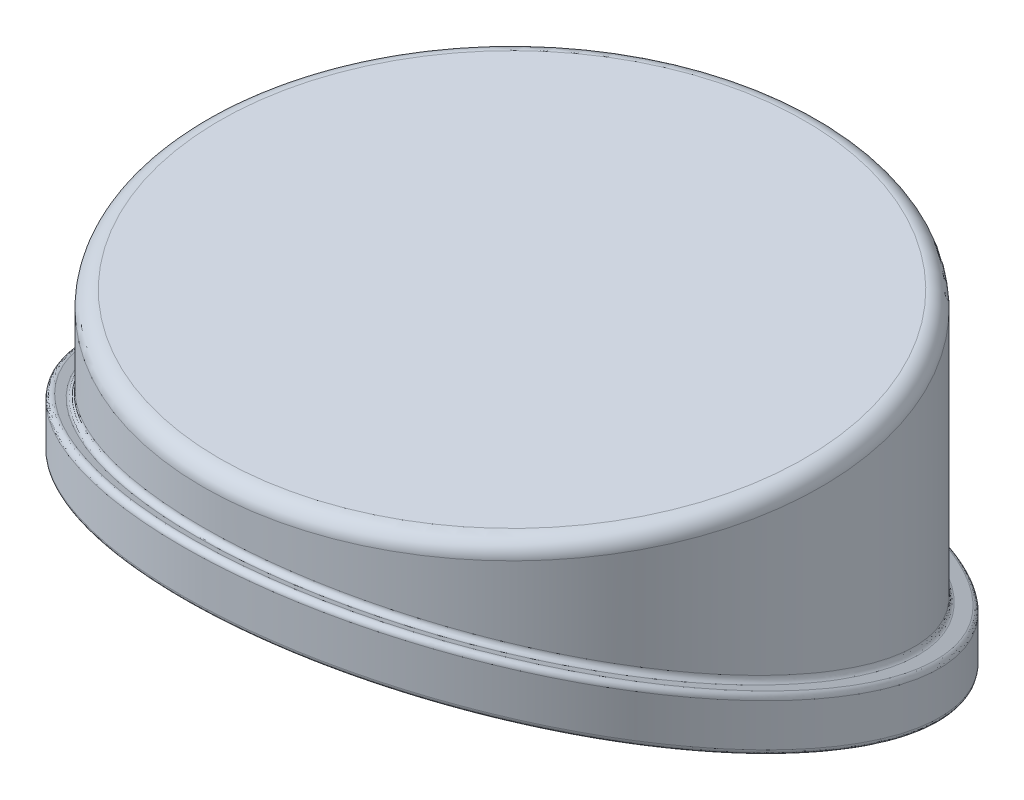
from build123d import *

# Parameters (mm, degrees)
SKETCH3_R                            = 40
BOSS_EXTRUDE3_DEPTH                  = 12.57807803
BOSS_EXTRUDE4_REACH                  = 59.95
BOSS_EXTRUDE4_END_RADIUS             = 40
BOSS_EXTRUDE4_DIRECTION_2_REACH      = 59.95
BOSS_EXTRUDE4_DIRECTION_2_END_RADIUS = 40
CUT_EXTRUDE3_REACH                   = 80.022
CUT_EXTRUDE3_OFFSET_FROM_SURFACE     = 6
SKETCH8_R                            = 40
SKETCH8_R_2                          = 37.5
FILLET1_R                            = 0.6
FILLET2_R                            = 2


with BuildPart() as part:
    # Sketch3 → Boss-Extrude3 (new body)
    with BuildSketch(Plane(origin=(0, 0, 0), x_dir=(1, 0, 0), z_dir=(0, 1, 0))):
        Circle(SKETCH3_R)
    extrude(amount=BOSS_EXTRUDE3_DEPTH)

    # Boss-Extrude4: up to this cylinder (the profile starts inside it)
    boss_extrude4_end = Plane(origin=(0, -10.666677, 0), z_dir=(0, -1, 0)) * Cylinder(BOSS_EXTRUDE4_END_RADIUS, 200.9, mode=Mode.PRIVATE)
    # Sketch6 → Boss-Extrude4 (add, up to the surface)
    with BuildSketch(Plane(origin=(0, 0, 0), x_dir=(0, 0, -1), z_dir=(1, 0, 0)), mode=Mode.PRIVATE) as boss_extrude4_sk1:
        Polygon((-40, 0), (40, -32.000030666), (40, 0), align=None)
    boss_extrude4_tool1 = extrude(boss_extrude4_sk1.sketch, amount=BOSS_EXTRUDE4_REACH, mode=Mode.PRIVATE) & boss_extrude4_end
    add(boss_extrude4_tool1.solids().sort_by_distance((0, -10.666677, -13.333333))[0])

    # Boss-Extrude4 direction 2: up to this cylinder (the profile starts inside it)
    boss_extrude4_direction_2_end = Plane(origin=(0, -10.666677, 0), z_dir=(0, -1, 0)) * Cylinder(BOSS_EXTRUDE4_DIRECTION_2_END_RADIUS, 200.9, mode=Mode.PRIVATE)
    # Sketch6 → Boss-Extrude4 direction 2 (add, up to the surface)
    with BuildSketch(Plane(origin=(0, 0, 0), x_dir=(0, 0, -1), z_dir=(1, 0, 0)), mode=Mode.PRIVATE) as boss_extrude4_direction_2_sk1:
        Polygon((-40, 0), (40, -32.000030666), (40, 0), align=None)
    boss_extrude4_direction_2_tool1 = extrude(boss_extrude4_direction_2_sk1.sketch, amount=-BOSS_EXTRUDE4_DIRECTION_2_REACH, mode=Mode.PRIVATE) & boss_extrude4_direction_2_end
    add(boss_extrude4_direction_2_tool1.solids().sort_by_distance((0, -10.666677, -13.333333))[0])

    # Cut-Extrude3: up to this face of the body (flat: up to its plane, moved by the offset)
    cut_extrude3_end = Plane(part.part.faces().sort_by_distance((0, -16.000015333, 0))[0]).offset(-CUT_EXTRUDE3_OFFSET_FROM_SURFACE)
    # Sketch8 → Cut-Extrude3 (cut, up to the picked face)
    with BuildSketch(Plane(origin=(0, 12.57807803, 0), x_dir=(1, 0, 0), z_dir=(0, 1, 0)), mode=Mode.PRIVATE) as cut_extrude3_sk1:
        Circle(SKETCH8_R)
        Circle(SKETCH8_R_2, mode=Mode.SUBTRACT)
    cut_extrude3_tool1 = split(extrude(cut_extrude3_sk1.sketch, amount=-CUT_EXTRUDE3_REACH, mode=Mode.PRIVATE), bisect_by=cut_extrude3_end, keep=Keep.BOTH, mode=Mode.PRIVATE)
    add(cut_extrude3_tool1.solids().sort_by(Axis((-38.868629, 12.578078, 0), (0, -1, 0)))[0], mode=Mode.SUBTRACT)

    # Fillet1
    fillet1_edges = [part.edges().sort_by_distance(p)[0] for p in [
        (40, -16.000015333, -1e-09),
        (0, 6.462198623, 40),
        (-37.5, -9.537771269, 0.000113603),
    ]]
    fillet(fillet1_edges, radius=FILLET1_R)

    # Fillet2
    fillet2_edges = [part.edges().sort_by_distance(p)[0] for p in [
        (-37.5, 12.57807803, 0),
    ]]
    fillet(fillet2_edges, radius=FILLET2_R)


solid = part.part
